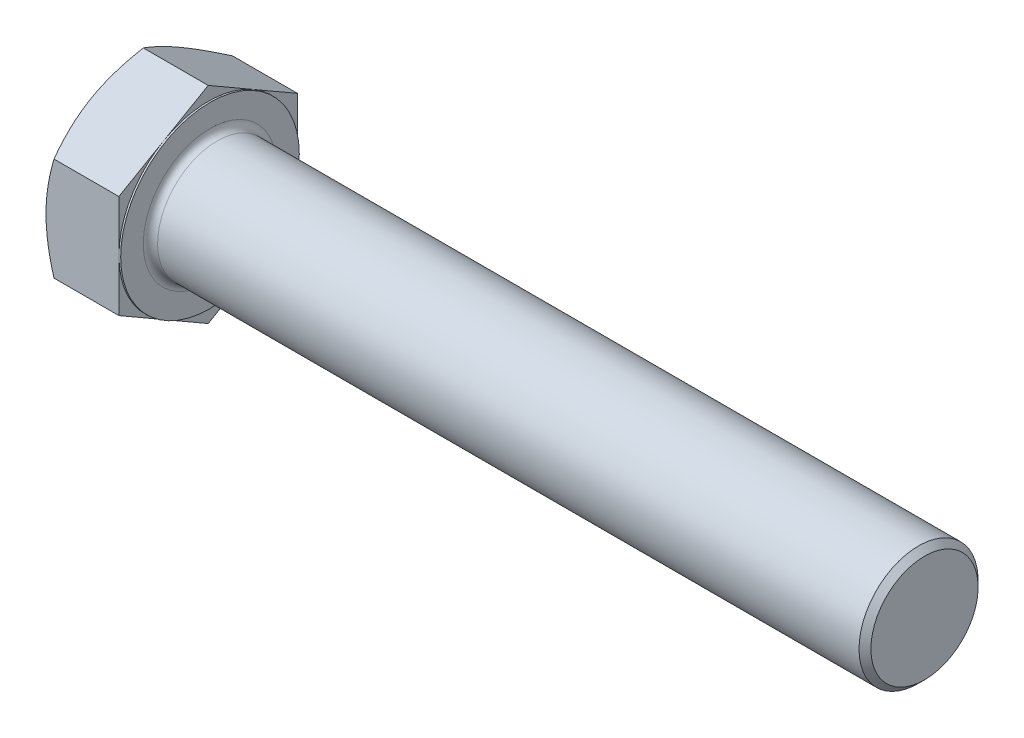
from build123d import *

# Parameters (mm, degrees)
BASEHEAD_DEPTH = 15.9258
SKETCH4_W      = 0.381
SKETCH4_H      = 28.347045256
HEADFILLET_R   = 1.524


with BuildPart() as part:
    # Sketch1 → BaseHead (new body)
    with BuildSketch(Plane(origin=(0, 0, 0), x_dir=(0, 0, -1), z_dir=(1, 0, 0))):
        Polygon((19.05, 10.998522628), (19.05, -10.998522628), (0, -21.997045256), (-19.05, -10.998522628), (-19.05, 10.998522628), (0, 21.997045256), align=None)
    extrude(amount=BASEHEAD_DEPTH)

    # BodySke → BaseBody (revolve)
    with BuildSketch(Plane.XY):
        Polygon((0, 0), (168.3258, 0), (168.3258, 11.43127), (167.05707, 12.7), (0, 12.7), align=None)
    revolve(axis=Axis((0, 0, 0), (1, 0, 0)))

    # Sketch3 → HeadChamfer (revolve, cut)
    with BuildSketch(Plane.XY):
        Polygon((0, 19.05), (5.367651581, 28.347045256), (5.367651581, 34.697045256), (-12.7, 34.697045256), (-12.7, 19.05), align=None)
    revolve(axis=Axis((0, 0, 0), (1, 0, 0)), mode=Mode.SUBTRACT)

    # Sketch4 → BearingFace (revolve, cut)
    with BuildSketch(Plane.XY):
        with Locations((15.7353, 33.223522628)):
            Rectangle(SKETCH4_W, SKETCH4_H)
    revolve(axis=Axis((0, 0, 0), (1, 0, 0)), mode=Mode.SUBTRACT)

    # HeadFillet
    headfillet_edges = [part.edges().sort_by_distance(p)[0] for p in [
        (15.9258, -12.7, 0),
    ]]
    fillet(headfillet_edges, radius=HEADFILLET_R)


solid = part.part
